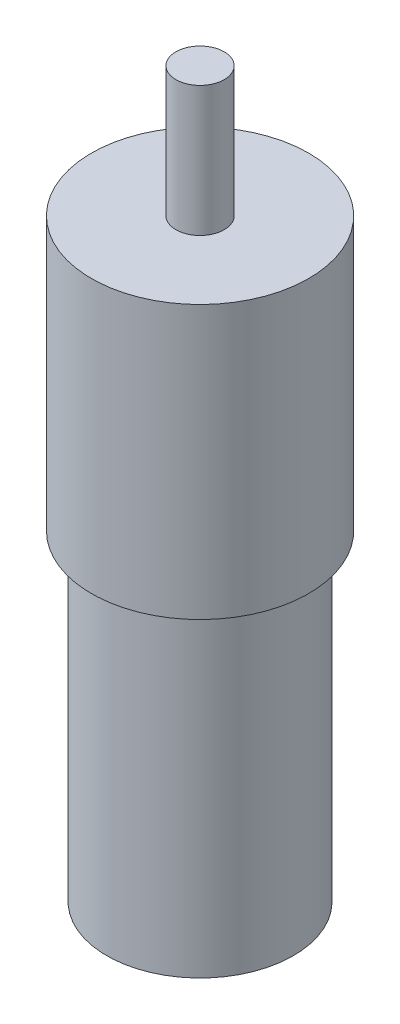
from build123d import *

# Parameters (mm, degrees)
SKETCH1_R           = 22.5044
BOSS_EXTRUDE1_DEPTH = 56.515
SKETCH2_R           = 4.99999
BOSS_EXTRUDE2_DEPTH = 26.924
SKETCH3_R           = 19.3294
BOSS_EXTRUDE3_DEPTH = 66.548


with BuildPart() as part:
    # Sketch1 → Boss-Extrude1 (new body)
    with BuildSketch(Plane(origin=(0, 0, 0), x_dir=(1, 0, 0), z_dir=(0, 1, 0))):
        Circle(SKETCH1_R)
    extrude(amount=BOSS_EXTRUDE1_DEPTH)

    # Sketch2 → Boss-Extrude2 (add)
    with BuildSketch(Plane(origin=(0, 56.515, 0), x_dir=(1, 0, 0), z_dir=(0, 1, 0))):
        Circle(SKETCH2_R)
    extrude(amount=BOSS_EXTRUDE2_DEPTH)

    # Sketch3 → Boss-Extrude3 (add)
    with BuildSketch(Plane.XZ):
        Circle(SKETCH3_R)
    extrude(amount=BOSS_EXTRUDE3_DEPTH)


solid = part.part
